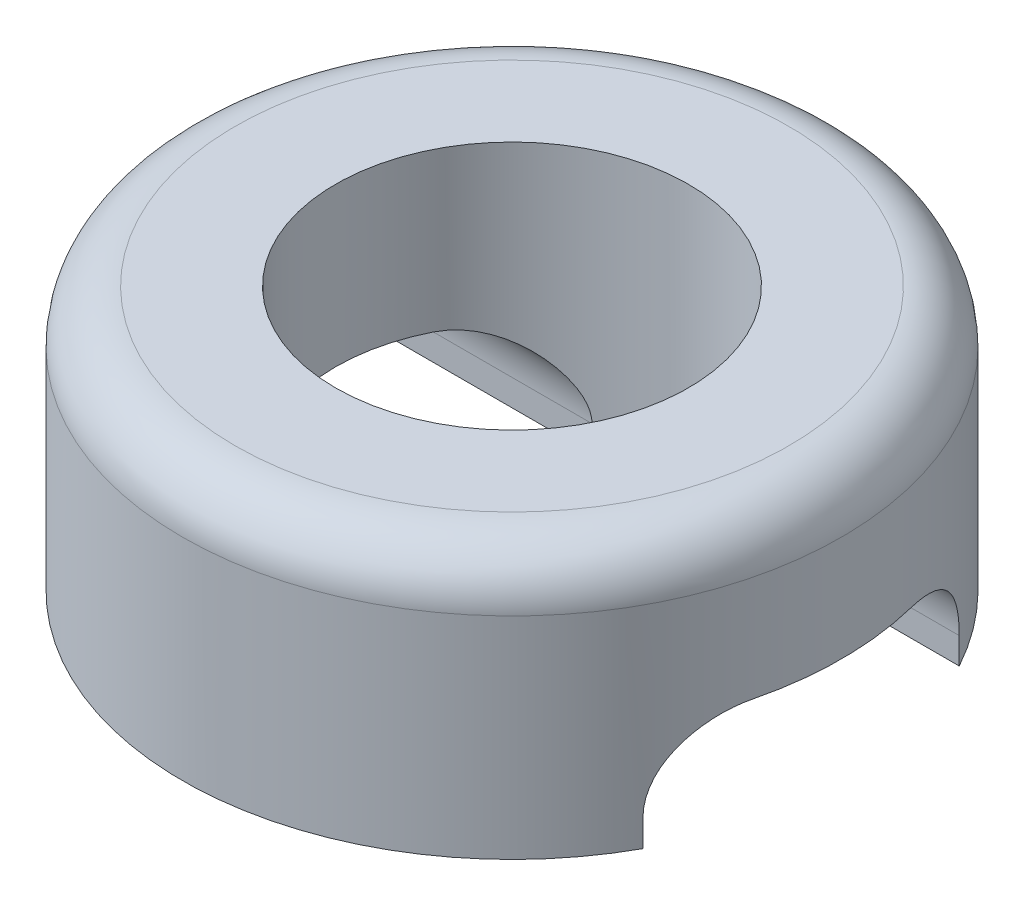
from build123d import *

# Parameters (mm, degrees)
SKETCH1_R               = 7.9375
SKETCH1_R_2             = 4.25
BOSS_EXTRUDE1_DEPTH     = 6.35
CUT_EXTRUDE1_DEPTH      = 13.896910967
CUT_EXTRUDE1_DEPTH_BACK = 13.896910967
SKETCH2_W               = 7.62
SKETCH2_H               = 2.54
FILLET2_R               = 1.905
FILLET3_R               = 1.27


with BuildPart() as part:
    # Sketch1 → Boss-Extrude1 (new body)
    with BuildSketch(Plane(origin=(0, 0, 0), x_dir=(1, 0, 0), z_dir=(0, 1, 0))):
        Circle(SKETCH1_R)
        Circle(SKETCH1_R_2, mode=Mode.SUBTRACT)
    extrude(amount=BOSS_EXTRUDE1_DEPTH)

    # Sketch2 → Cut-Extrude1 (cut, two sides: drawn at the far end of the back side and taken through both)
    with BuildSketch(Plane(origin=(0, 0, 0), x_dir=(0, 0, -1), z_dir=(1, 0, 0)).offset(-CUT_EXTRUDE1_DEPTH_BACK)):
        with Locations((0, 1.27)):
            Rectangle(SKETCH2_W, SKETCH2_H)
    extrude(amount=CUT_EXTRUDE1_DEPTH + CUT_EXTRUDE1_DEPTH_BACK, mode=Mode.SUBTRACT)

    # Fillet2
    fillet2_edges = [part.edges().sort_by_distance(p)[0] for p in [
        (4.423253704, 2.54, -3.81),
        (-4.423253704, 2.54, -3.81),
        (4.423253704, 2.54, 3.81),
        (-4.423253704, 2.54, 3.81),
    ]]
    fillet(fillet2_edges, radius=FILLET2_R)

    # Fillet3
    fillet3_edges = [part.edges().sort_by_distance(p)[0] for p in [
        (-7.9375, 6.35, 0),
    ]]
    fillet(fillet3_edges, radius=FILLET3_R)


solid = part.part
